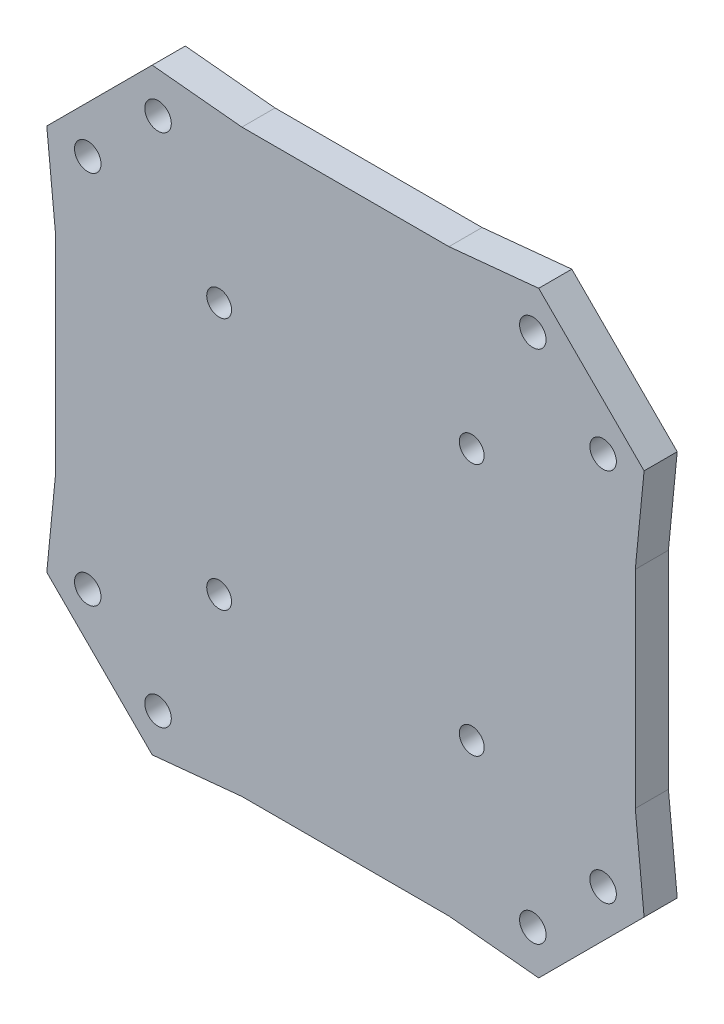
from build123d import *

# Parameters (mm, degrees)
SKETCH1_R            = 1.6
BOSS_EXTRUDE1_DEPTH  = 4
CUT_EXTRUDE1_DEPTH   = 2
CUT_EXTRUDE2_DEPTH   = 1.5
SKETCH4_R            = 1.5
CUT_EXTRUDE3_DEPTH   = 52.039200621
BOSS_EXTRUDE2_START  = 1.5
SKETCH5_R            = 4
SKETCH5_R_2          = 1.5
BOSS_EXTRUDE2_DEPTH  = 1.5
FILLET1_R            = 2
FILLET1_OF_MIRROR1_R = 2
MIRROR2_3_OUTLINE_W  = 1.5
MIRROR2_3_OUTLINE_H  = 2
MIRROR2_4_OUTLINE_W  = 1.5
MIRROR2_4_OUTLINE_H  = 2


# Read off the part's stored shape, not the designer's step: Mirror2
with BuildPart() as part:
    # Sketch1 → Boss-Extrude1 (new body)
    with BuildSketch(Plane.XY):
        Polygon((-35, 12.5), (-36.062445841, 23.334523779), (-23.334523779, 36.062445841), (-12.5, 35), (12.5, 35), (23.334523779, 36.062445841), (36.062445841, 23.334523779), (35, 12.5), (35, -12.5), (36.062445841, -23.334523779), (23.334523779, -36.062445841), (12.5, -35), (-12.5, -35), (-23.334523779, -36.062445841), (-36.062445841, -23.334523779), (-35, -12.5), align=None)
        with Locations((-22.627416998, 31.112698372)):
            Circle(SKETCH1_R, mode=Mode.SUBTRACT)
        with Locations((-31.112698372, 22.627416998)):
            Circle(SKETCH1_R, mode=Mode.SUBTRACT)
        with Locations((-31.112698372, -22.627416998)):
            Circle(SKETCH1_R, mode=Mode.SUBTRACT)
        with Locations((-22.627416998, -31.112698372)):
            Circle(SKETCH1_R, mode=Mode.SUBTRACT)
        with Locations((22.627416998, -31.112698372)):
            Circle(SKETCH1_R, mode=Mode.SUBTRACT)
        with Locations((31.112698372, -22.627416998)):
            Circle(SKETCH1_R, mode=Mode.SUBTRACT)
        with Locations((31.112698372, 22.627416998)):
            Circle(SKETCH1_R, mode=Mode.SUBTRACT)
        with Locations((22.627416998, 31.112698372)):
            Circle(SKETCH1_R, mode=Mode.SUBTRACT)
    extrude(amount=BOSS_EXTRUDE1_DEPTH)

    # Sketch2 → Cut-Extrude1 (cut)
    with BuildSketch(Plane(origin=(0, 0, 0), x_dir=(-1, 0, 0), z_dir=(0, 0, -1))):
        Polygon((-17.669047558, 29), (17.669047558, 29), (29, 17.669047558), (29, -17.669047558), (17.669047558, -29), (-17.669047558, -29), (-29, -17.669047558), (-29, 17.669047558), align=None)
    extrude(amount=-CUT_EXTRUDE1_DEPTH, mode=Mode.SUBTRACT)

    # Sketch3 → Cut-Extrude2 (cut)
    with BuildSketch(Plane(origin=(0, 0, 2), x_dir=(-1, 0, 0), z_dir=(0, 0, -1))):
        with BuildLine():
            Line((-24.58547182, -11.125115865), (-16.58547182, -6.847712761))
            ThreePointArc((-16.58547182, -6.847712761), (-15.426715665, -5.744273519), (-15, -4.202129644))
            Line((-15, -4.202129644), (-15, 4.202129644))
            ThreePointArc((-15, 4.202129644), (-15.426715665, 5.744273519), (-16.58547182, 6.847712761))
            Line((-16.58547182, 6.847712761), (-24.58547182, 11.125115865))
            ThreePointArc((-24.58547182, 11.125115865), (-27.542143875, 11.052817083), (-29, 8.479532748))
            Line((-29, 8.479532748), (-29, -8.479532748))
            ThreePointArc((-29, -8.479532748), (-27.542143875, -11.052817083), (-24.58547182, -11.125115865))
        make_face()
        with BuildLine():
            Line((6.847712761, 16.58547182), (11.125115865, 24.58547182))
            ThreePointArc((11.125115865, 24.58547182), (11.052817083, 27.542143875), (8.479532748, 29))
            Line((8.479532748, 29), (-8.479532748, 29))
            ThreePointArc((-8.479532748, 29), (-11.052817083, 27.542143875), (-11.125115865, 24.58547182))
            Line((-11.125115865, 24.58547182), (-6.847712761, 16.58547182))
            ThreePointArc((-6.847712761, 16.58547182), (-5.744273519, 15.426715665), (-4.202129644, 15))
            Line((-4.202129644, 15), (4.202129644, 15))
            ThreePointArc((4.202129644, 15), (5.744273519, 15.426715665), (6.847712761, 16.58547182))
        make_face()
        with BuildLine():
            Line((16.58547182, -6.847712761), (24.58547182, -11.125115865))
            ThreePointArc((24.58547182, -11.125115865), (27.542143875, -11.052817083), (29, -8.479532748))
            Line((29, -8.479532748), (29, 8.479532748))
            ThreePointArc((29, 8.479532748), (27.542143875, 11.052817083), (24.58547182, 11.125115865))
            Line((24.58547182, 11.125115865), (16.58547182, 6.847712761))
            ThreePointArc((16.58547182, 6.847712761), (15.426715665, 5.744273519), (15, 4.202129644))
            Line((15, 4.202129644), (15, -4.202129644))
            ThreePointArc((15, -4.202129644), (15.426715665, -5.744273519), (16.58547182, -6.847712761))
        make_face()
        with BuildLine():
            Line((-6.847712761, -16.58547182), (-11.125115865, -24.58547182))
            ThreePointArc((-11.125115865, -24.58547182), (-11.052817083, -27.542143875), (-8.479532748, -29))
            Line((-8.479532748, -29), (8.479532748, -29))
            ThreePointArc((8.479532748, -29), (11.052817083, -27.542143875), (11.125115865, -24.58547182))
            Line((11.125115865, -24.58547182), (6.847712761, -16.58547182))
            ThreePointArc((6.847712761, -16.58547182), (5.744273519, -15.426715665), (4.202129644, -15))
            Line((4.202129644, -15), (-4.202129644, -15))
            ThreePointArc((-4.202129644, -15), (-5.744273519, -15.426715665), (-6.847712761, -16.58547182))
        make_face()
    extrude(amount=-CUT_EXTRUDE2_DEPTH, mode=Mode.SUBTRACT)

    # Sketch4 → Cut-Extrude3 (cut, through all)
    with BuildSketch(Plane(origin=(0, 0, 2), x_dir=(-1, 0, 0), z_dir=(0, 0, -1))):
        with Locations((15.25, 15.25)):
            Circle(SKETCH4_R)
    cut_extrude3 = extrude(amount=-CUT_EXTRUDE3_DEPTH, mode=Mode.SUBTRACT)

    # Sketch5 → Boss-Extrude2 (add)
    with BuildSketch(Plane(origin=(0, 0, 2), x_dir=(-1, 0, 0), z_dir=(0, 0, -1)).offset(BOSS_EXTRUDE2_START)):
        with Locations(Location((15.25, 15.25, 0), (0, 0, 180))):
            Circle(SKETCH5_R)
        with Locations((15.25, 15.25)):
            Circle(SKETCH5_R_2, mode=Mode.SUBTRACT)
    boss_extrude2 = extrude(amount=-BOSS_EXTRUDE2_DEPTH)

    # Fillet1
    # the kernel refuses this fillet: 2 mm, written as the material it adds along each edge
    with BuildSketch(Plane(origin=(-15.25, 15.25, 2), x_dir=(1, 0, 0), z_dir=(0, 1, 0))) as fillet1_piece_1:
        with BuildLine():
            CenterArc((5.936491673, 2), FILLET1_R, 194.477512186, 75.522487814)
            Line((5.936491673, 0), (5.936491673, -0.04))
            Line((5.936491673, -0.04), (4, -0.04))
            Line((4, -0.04), (3.96, 0))
            ThreePointArc((3.96, 0), (3.96, 0.75), (3.961270167, 1.49))
            Line((3.961270167, 1.49), (4, 1.5))
        make_face()
    revolve(axis=Axis((-15.25, 15.25, 2), (0, 0, -1)))

    # Mirror1: Cut-Extrude3, Boss-Extrude2 across plane
    add(cut_extrude3.mirror(Plane(origin=(0, 0, 0), x_dir=(0, 0, 1), z_dir=(1, 0, 0))), mode=Mode.SUBTRACT)
    add(boss_extrude2.mirror(Plane(origin=(0, 0, 0), x_dir=(0, 0, 1), z_dir=(1, 0, 0))))

    # Fillet1 of Mirror1
    # the kernel refuses this fillet: 2 mm, written as the material it adds along each edge
    with BuildSketch(Plane(origin=(15.25, 15.25, 2), x_dir=(-1, 0, 0), z_dir=(0, 1, 0))) as fillet1_of_mirror1_piece_1:
        with BuildLine():
            CenterArc((5.936491673, -2), FILLET1_OF_MIRROR1_R, 90, 75.522487814)
            Line((5.936491673, 0), (5.936491673, 0.04))
            Line((5.936491673, 0.04), (4, 0.04))
            Line((4, 0.04), (3.96, 0))
            ThreePointArc((3.96, 0), (3.96, -0.75), (3.961270167, -1.49))
            Line((3.961270167, -1.49), (4, -1.5))
        make_face()
    revolve(axis=Axis((15.25, 15.25, 2), (0, 0, 1)))

    # Mirror2 outline → Mirror2 (revolve)
    with BuildSketch(Plane(origin=(15.25, -15.25, 0), x_dir=(1, 0, 0), z_dir=(0, -1, 0))):
        with BuildLine():
            Line((1.5, 2), (1.5, 0.5))
            Line((1.5, 0.5), (4, 0.5))
            ThreePointArc((4, 0.5), (4.711746802, 1.58113883), (5.936491673, 2))
            Line((5.936491673, 2), (1.5, 2))
        make_face()
    revolve(axis=Axis((15.25, -15.25, 0), (0, 0, 1)))

    # Mirror2 2 outline → Mirror2 2 (revolve)
    with BuildSketch(Plane(origin=(-15.25, -15.25, 0), x_dir=(1, 0, 0), z_dir=(0, -1, 0))):
        with BuildLine():
            Line((1.5, 2), (1.5, 0.5))
            Line((1.5, 0.5), (4, 0.5))
            ThreePointArc((4, 0.5), (4.711746802, 1.58113883), (5.936491673, 2))
            Line((5.936491673, 2), (1.5, 2))
        make_face()
    revolve(axis=Axis((-15.25, -15.25, 0), (0, 0, 1)))

    # Mirror2 3 outline → Mirror2 3 (revolve, cut)
    with BuildSketch(Plane(origin=(15.25, -15.25, 0), x_dir=(1, 0, 0), z_dir=(0, -1, 0))):
        with Locations((0.75, 3)):
            Rectangle(MIRROR2_3_OUTLINE_W, MIRROR2_3_OUTLINE_H)
    revolve(axis=Axis((15.25, -15.25, 0), (0, 0, 1)), mode=Mode.SUBTRACT)

    # Mirror2 4 outline → Mirror2 4 (revolve, cut)
    with BuildSketch(Plane(origin=(-15.25, -15.25, 0), x_dir=(1, 0, 0), z_dir=(0, -1, 0))):
        with Locations((0.75, 3)):
            Rectangle(MIRROR2_4_OUTLINE_W, MIRROR2_4_OUTLINE_H)
    revolve(axis=Axis((-15.25, -15.25, 0), (0, 0, 1)), mode=Mode.SUBTRACT)


solid = part.part
